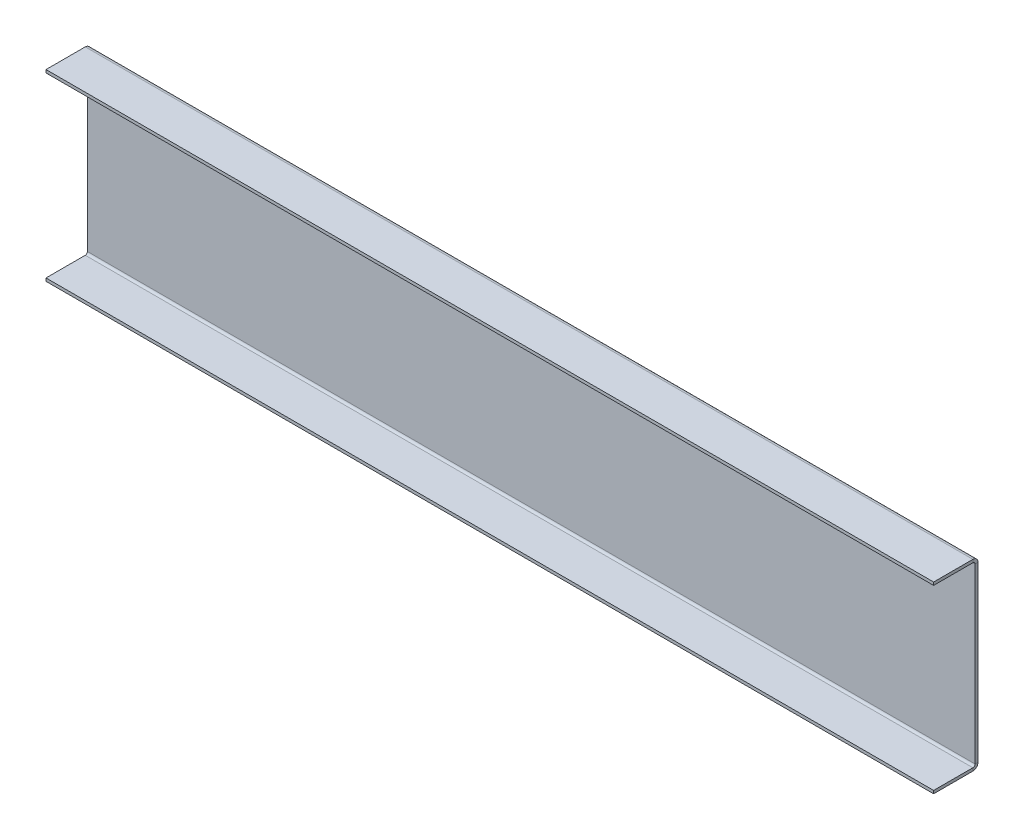
from build123d import *

# Parameters (mm, degrees)
SKETCH1_W                      = 300
SKETCH1_H                      = 60
BASE_FLANGE1_DEPTH             = 1
EDGE_FLANGE1_STRIP_W           = 5.4732
EDGE_FLANGE1_STRIP_H           = 1
EDGE_FLANGE1_STRIP_CUT_DEPTH   = 300
EDGE_FLANGE1_STRIP_2_W         = 5.4732
EDGE_FLANGE1_STRIP_2_H         = 1
EDGE_FLANGE1_STRIP_CUT_2_DEPTH = 300
EDGE_FLANGE1_DEPTH             = 300
EDGE_FLANGE1_BEND_DEPTH        = 300


# Sheet-metal steps are written as plain solids
with BuildPart() as part:
    # Sketch1 → Base-Flange1 (new body)
    with BuildSketch(Plane.XY):
        Rectangle(SKETCH1_W, SKETCH1_H)
    extrude(amount=-BASE_FLANGE1_DEPTH)

    # Edge-Flange1 strip (across the edge) → Edge-Flange1 strip cut (cut)
    with BuildSketch(Plane(origin=(150, 30, 0), x_dir=(0, -1, 0), z_dir=(-1, 0, 0))):
        with Locations((-2, -0.5)):
            Rectangle(EDGE_FLANGE1_STRIP_W, EDGE_FLANGE1_STRIP_H)
    extrude(amount=EDGE_FLANGE1_STRIP_CUT_DEPTH, mode=Mode.SUBTRACT)

    # Edge-Flange1 strip 2 (across the edge) → Edge-Flange1 strip cut 2 (cut)
    with BuildSketch(Plane(origin=(-150, -30, 0), x_dir=(0, 1, 0), z_dir=(1, 0, 0))):
        with Locations((-2, -0.5)):
            Rectangle(EDGE_FLANGE1_STRIP_2_W, EDGE_FLANGE1_STRIP_2_H)
    extrude(amount=EDGE_FLANGE1_STRIP_CUT_2_DEPTH, mode=Mode.SUBTRACT)

    # Edge-Flange1 section (across the edge) → Edge-Flange1 (add)
    with BuildSketch(Plane(origin=(150, 30, 0), x_dir=(0, -1, 0), z_dir=(-1, 0, 0))):
        with BuildLine():
            Line((-1, 0.7366), (-1, 14))
            Line((-1, 14), (0, 14))
            Line((0, 14), (0, 0.7366))
            ThreePointArc((0, 0.7366), (0.215745145, 0.215745145), (0.7366, 0))
            Line((0.7366, 0), (0.7366, -1))
            ThreePointArc((0.7366, -1), (-0.491361636, -0.491361636), (-1, 0.7366))
        make_face()
    extrude(amount=EDGE_FLANGE1_DEPTH)

    # Edge-Flange1 section 2 (across the edge) → Edge-Flange1 bend (add)
    with BuildSketch(Plane(origin=(-150, -30, 0), x_dir=(0, 1, 0), z_dir=(1, 0, 0))):
        with BuildLine():
            Line((-1, 0.7366), (-1, 14))
            Line((-1, 14), (0, 14))
            Line((0, 14), (0, 0.7366))
            ThreePointArc((0, 0.7366), (0.215745145, 0.215745145), (0.7366, 0))
            Line((0.7366, 0), (0.7366, -1))
            ThreePointArc((0.7366, -1), (-0.491361636, -0.491361636), (-1, 0.7366))
        make_face()
    extrude(amount=EDGE_FLANGE1_BEND_DEPTH)


solid = part.part
